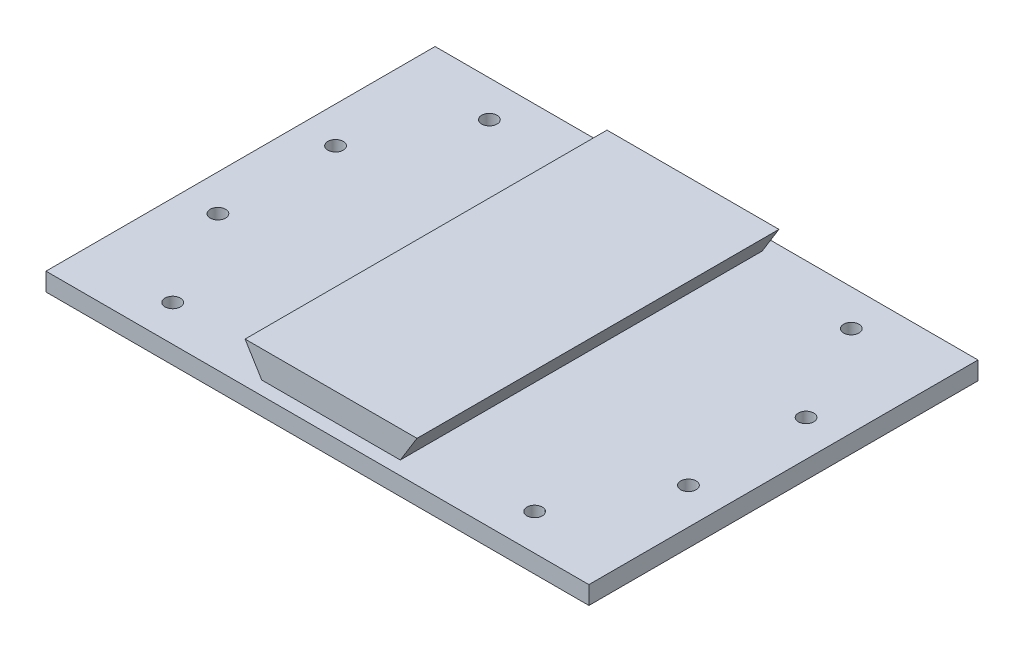
from build123d import *

# Parameters (mm, degrees)
SKETCH1_W             = 120
SKETCH1_H             = 86
RAIL_PLATE_DEPTH      = 4
DOVETAIL_RAIL_DEPTH   = 40
BOLT_HOLES_DEPTH      = 75.491610266
BOLT_HOLES_DEPTH_BACK = 75.491610266
SKETCH3_R             = 1.7


with BuildPart() as part:
    # Sketch1 → Rail Plate (new body)
    with BuildSketch(Plane(origin=(0, 0, 0), x_dir=(1, 0, 0), z_dir=(0, 1, 0))):
        Rectangle(SKETCH1_W, SKETCH1_H)
    extrude(amount=RAIL_PLATE_DEPTH)

    # Sketch2 → Dovetail Rail (add, symmetric)
    with BuildSketch(Plane.XY):
        Polygon((-15, 3.5), (15, 3.5), (19, 10), (-19, 10), align=None)
    extrude(amount=DOVETAIL_RAIL_DEPTH, both=True)

    # Sketch3 → Bolt Holes (cut, two sides: drawn at the far end of the back side and taken through both)
    with BuildSketch(Plane(origin=(0, 0, 0), x_dir=(1, 0, 0), z_dir=(0, 1, 0)).offset(-BOLT_HOLES_DEPTH_BACK)):
        with Locations((-40, -35)):
            Circle(SKETCH3_R)
        with Locations((-40, 35)):
            Circle(SKETCH3_R)
        with Locations((40, -35)):
            Circle(SKETCH3_R)
        with Locations((40, 35)):
            Circle(SKETCH3_R)
        with Locations((-52, -13)):
            Circle(SKETCH3_R)
        with Locations((-52, 13)):
            Circle(SKETCH3_R)
        with Locations((52, -13)):
            Circle(SKETCH3_R)
        with Locations((52, 13)):
            Circle(SKETCH3_R)
    extrude(amount=BOLT_HOLES_DEPTH + BOLT_HOLES_DEPTH_BACK, mode=Mode.SUBTRACT)


solid = part.part
